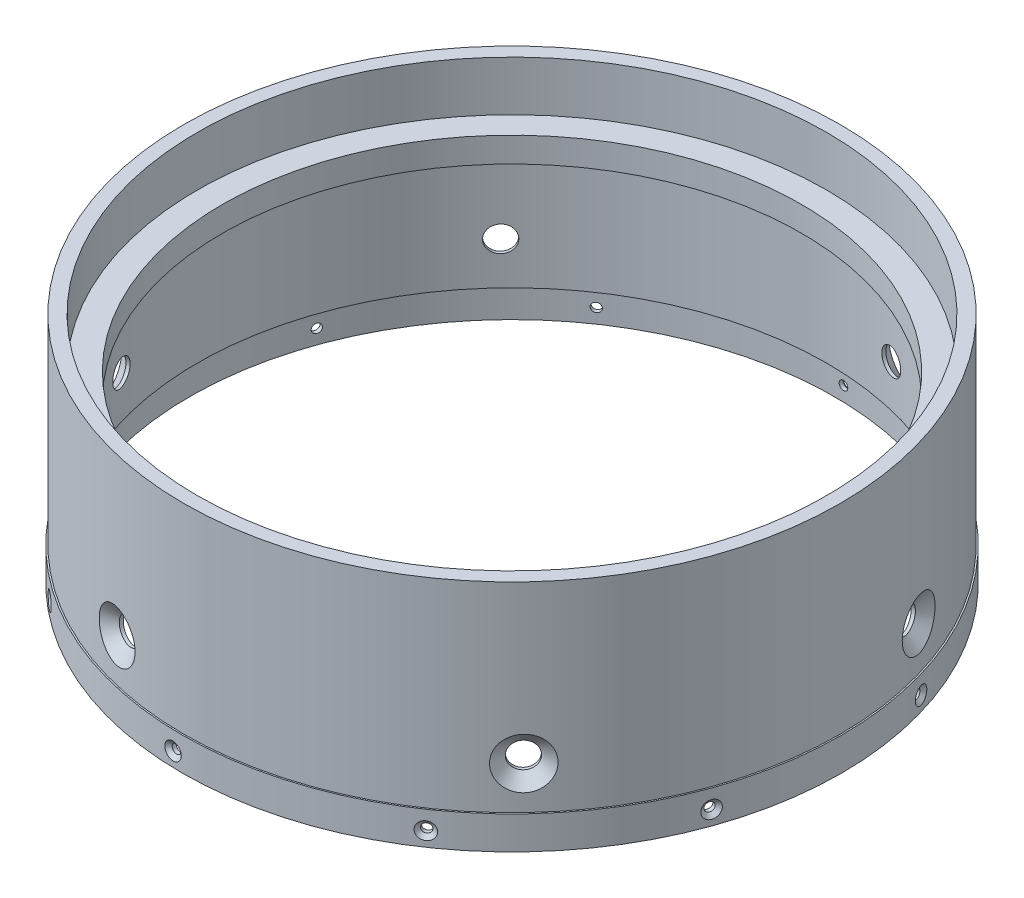
from build123d import *

# Parameters (mm, degrees)
CIRPATTERN1_COUNT = 10
CIRPATTERN2_COUNT = 6


with BuildPart() as part:
    # Sketch2 → Revolve1 (revolve)
    with BuildSketch(Plane(origin=(0, 0, 0), x_dir=(0, 0, -1), z_dir=(1, 0, 0))):
        Polygon((79.99222, 10.507544326), (83.439, 10.507544326), (83.439, -40.292455674), (83.82, -40.292455674), (83.82, -48.674455674), (81.9531, -48.674455674), (81.9531, -40.292455674), (79.99222, -40.292455674), (79.99222, -8.542455674), (73.64222, -8.542455674), (73.64222, -2.192455674), (79.99222, -2.192455674), align=None)
    revolve(axis=Axis((0, 0, 0), (0, -1, 0)))

    # Sketch3 → CSK for #2 Flat Head Machine Screw (100)1 (revolve, cut)
    with BuildSketch(Plane(origin=(2.413258622, -45.008517513, -83.785252777), x_dir=(-0.999585454265213, 0, -0.028790964231994103), z_dir=(0, 1, 0))):
        Polygon((0, 0), (0, 76.879152758), (1.1303, 76.2), (1.1303, 0.884494921), (2.1844, 0), align=None)
    csk_for_2_flat_head_machine_screw_100 = revolve(axis=Axis((2.596081245, -45.008517513, -90.132620411), (-0.028790964231994103, 0, 0.999585454265213)), mode=Mode.SUBTRACT)

    # CirPattern1: CSK for #2 Flat Head Machine Screw (100)1 ×10 about axis
    cirpattern1_axis = Axis((0, 0, 0), (0, 1, 0))
    for i in range(1, CIRPATTERN1_COUNT):
        add(csk_for_2_flat_head_machine_screw_100.rotate(cirpattern1_axis, i * 360 / CIRPATTERN1_COUNT), mode=Mode.SUBTRACT)

    # Sketch4 → CSK for 1/4 Flat Head Machine Screw (100)1 (revolve, cut)
    with BuildSketch(Plane(origin=(80.020293691, -29.487820217, -23.639359524), x_dir=(-0.2833130733057889, 0, -0.9590274774447439), z_dir=(0, 1, 0))):
        Polygon((0, 0), (0, 27.361148974), (3.2639, 25.4), (3.2639, 2.664141329), (6.4389, 0), align=None)
    csk_for_1_4_flat_head_machine_screw_100 = revolve(axis=Axis((86.110118172, -29.487820217, -25.438397539), (-0.9590274774447438, 0, 0.2833130733057889)), mode=Mode.SUBTRACT)

    # CirPattern2: CSK for 1/4 Flat Head Machine Screw (100)1 ×6 about axis
    cirpattern2_axis = Axis((0, 0, 0), (0, 1, 0))
    for i in range(1, CIRPATTERN2_COUNT):
        add(csk_for_1_4_flat_head_machine_screw_100.rotate(cirpattern2_axis, i * 360 / CIRPATTERN2_COUNT), mode=Mode.SUBTRACT)


solid = part.part
